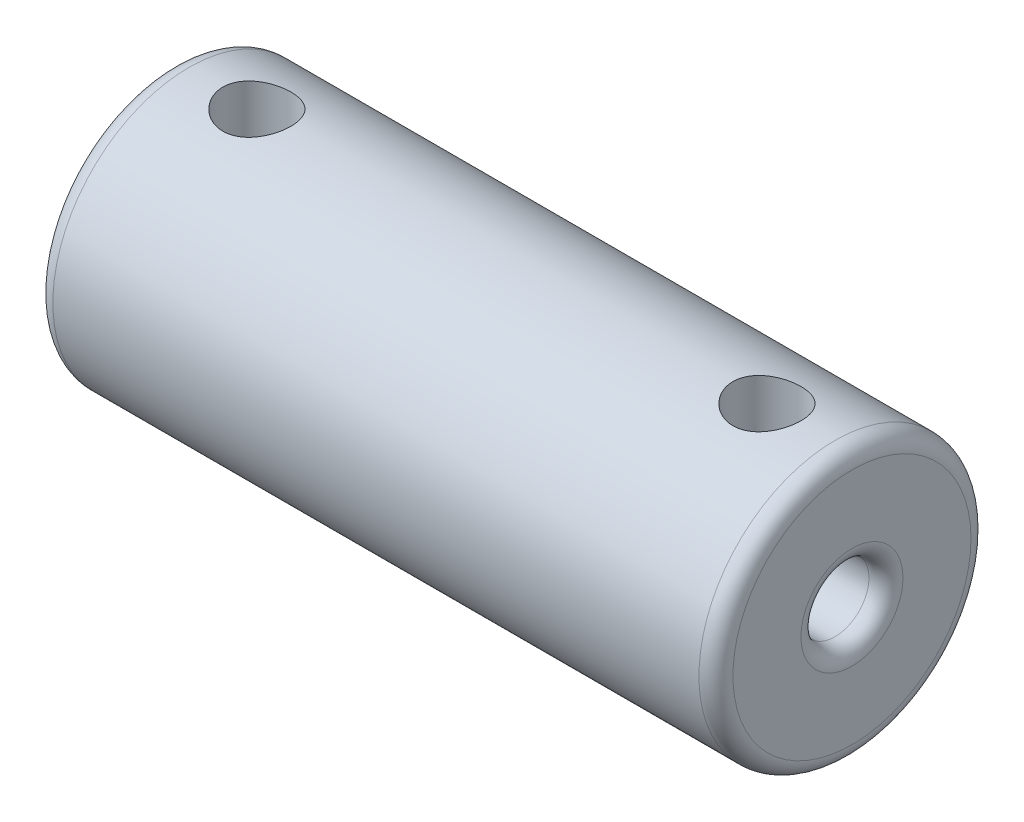
from build123d import *

# Parameters (mm, degrees)
BOSS_EXTRUDE1_DEPTH      = 10
BOSS_EXTRUDE1_DEPTH_BACK = 10
SKETCH1_R                = 4
SKETCH2_R                = 1
CUT_EXTRUDE1_DEPTH       = 10
SKETCH3_R                = 2
CUT_EXTRUDE2_DEPTH       = 10
CUT_EXTRUDE4_REACH       = 13.489
SKETCH4_R                = 1
FILLET1_R                = 0.5


with BuildPart() as part:
    # Sketch1 → Boss-Extrude1 (new, two sides: drawn at the far end of the back side and taken through both)
    with BuildSketch(Plane(origin=(0, 0, 0), x_dir=(0, 0, -1), z_dir=(1, 0, 0)).offset(-BOSS_EXTRUDE1_DEPTH_BACK)):
        Circle(SKETCH1_R)
    extrude(amount=BOSS_EXTRUDE1_DEPTH + BOSS_EXTRUDE1_DEPTH_BACK)

    # Sketch2 → Cut-Extrude1 (cut)
    with BuildSketch(Plane(origin=(10, 0, 0), x_dir=(0, 0, -1), z_dir=(1, 0, 0))):
        Circle(SKETCH2_R)
    extrude(amount=-CUT_EXTRUDE1_DEPTH, mode=Mode.SUBTRACT)

    # Sketch3 → Cut-Extrude2 (cut)
    with BuildSketch(Plane.ZY.offset(10)):
        Circle(SKETCH3_R)
    extrude(amount=-CUT_EXTRUDE2_DEPTH, mode=Mode.SUBTRACT)

    # Sketch4 → Cut-Extrude4 (cut, up to next)
    with BuildSketch(Plane(origin=(0, 0, 0), x_dir=(1, 0, 0), z_dir=(0, 1, 0)), mode=Mode.PRIVATE) as cut_extrude4_sk1:
        with Locations((-7.5, 0)):
            Circle(SKETCH4_R)
    cut_extrude4_tool1 = extrude(cut_extrude4_sk1.sketch, amount=CUT_EXTRUDE4_REACH, mode=Mode.PRIVATE) & part.part
    # Sketch4 → Cut-Extrude4 (cut, up to next)
    with BuildSketch(Plane(origin=(0, 0, 0), x_dir=(1, 0, 0), z_dir=(0, 1, 0)), mode=Mode.PRIVATE) as cut_extrude4_sk2:
        with Locations((7.5, 0)):
            Circle(SKETCH4_R)
    cut_extrude4_tool2 = extrude(cut_extrude4_sk2.sketch, amount=CUT_EXTRUDE4_REACH, mode=Mode.PRIVATE) & part.part
    add(cut_extrude4_tool1.solids().sort_by_distance((-7.5, 0, 0))[0], mode=Mode.SUBTRACT)
    add(cut_extrude4_tool2.solids().sort_by_distance((7.5, 0, 0))[0], mode=Mode.SUBTRACT)

    # Fillet1
    fillet1_edges = [part.edges().sort_by_distance(p)[0] for p in [
        (10, 0, 1),
        (10, 0, 4),
        (-10, 0, 4),
        (-10, 0, -2),
    ]]
    fillet(fillet1_edges, radius=FILLET1_R)


solid = part.part
